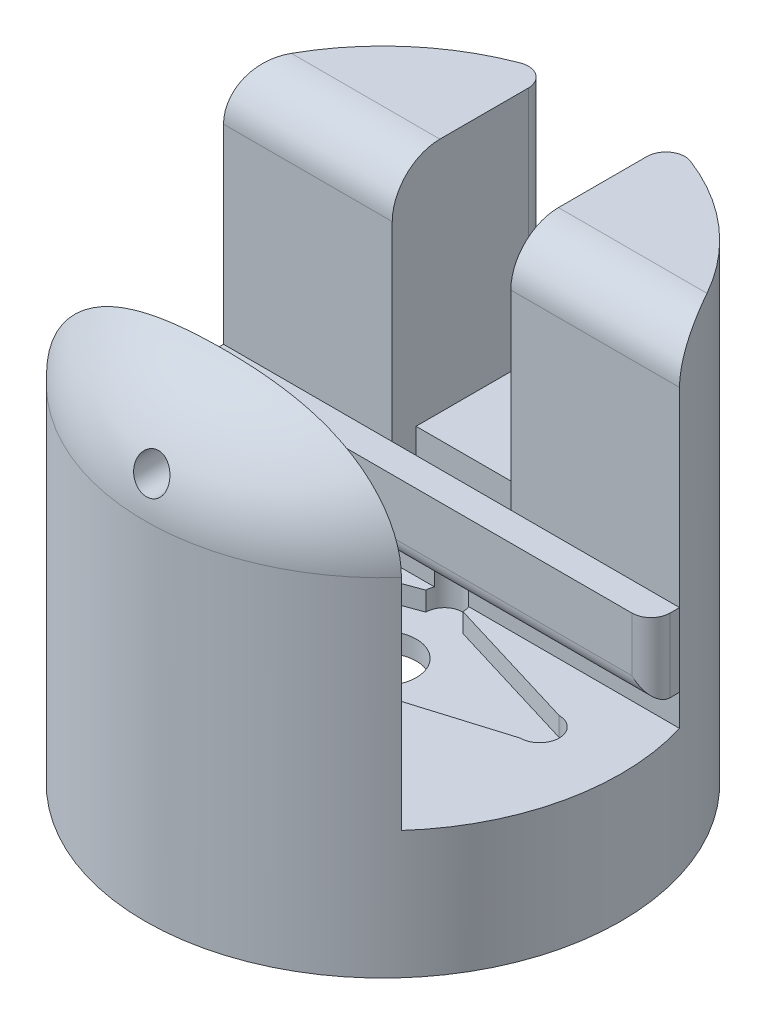
from build123d import *

# Parameters (mm, degrees)
SKETCH1_R           = 25
SKETCH1_R_2         = 22.5
BOSS_EXTRUDE1_DEPTH = 9.4
SKETCH2_R           = 25
BOSS_EXTRUDE2_DEPTH = 40
SKETCH3_W           = 55.38055132
SKETCH3_H           = 33.998264421
CUT_EXTRUDE1_DEPTH  = 36
SKETCH4_R           = 3.5
CUT_EXTRUDE2_DEPTH  = 36
CUT_EXTRUDE3_START  = -2
SKETCH5_R           = 3.5
SKETCH5_R_2         = 2.05
SKETCH5_R_3         = 1.95
CUT_EXTRUDE3_DEPTH  = 2
SKETCH5_3_R         = 1.95
CUT_EXTRUDE4_DEPTH  = 2
SKETCH6_W           = 12.45
SKETCH6_H           = 22.55
CUT_EXTRUDE5_DEPTH  = 42
SKETCH6_4_W         = 12.45
SKETCH6_4_H         = 4.85
CUT_EXTRUDE6_DEPTH  = 2.5
SKETCH6_5_W         = 12.45
SKETCH6_5_H         = 2.312362619
CUT_EXTRUDE7_DEPTH  = 28.5
SKETCH7_W           = 47.88210926
SKETCH7_H           = 3
BOSS_EXTRUDE3_DEPTH = 3
SKETCH8_W           = 47.88210926
SKETCH8_H           = 3
BOSS_EXTRUDE4_DEPTH = 4.7
FILLET1_R           = 5
FILLET2_R           = 2
FILLET3_R           = 2
BOSS_EXTRUDE5_DEPTH = 35
FILLET4_R           = 12
SKETCH10_R          = 1.8
CUT_EXTRUDE8_DEPTH  = 36


with BuildPart() as part:
    # Sketch1 → Boss-Extrude1 (new body)
    with BuildSketch(Plane(origin=(0, 0, 0), x_dir=(1, 0, 0), z_dir=(0, 1, 0))):
        with Locations(Location((0, 0, 0), (0, 0, 270))):
            Circle(SKETCH1_R)
        with Locations(Location((0, 0, 0), (0, 0, 270))):
            Circle(SKETCH1_R_2, mode=Mode.SUBTRACT)
    extrude(amount=BOSS_EXTRUDE1_DEPTH)

    # Sketch2 → Boss-Extrude2 (add)
    with BuildSketch(Plane(origin=(0, 9.4, 0), x_dir=(1, 0, 0), z_dir=(0, 1, 0))):
        with Locations(Location((0, 0, 0), (0, 0, 270))):
            Circle(SKETCH2_R)
    extrude(amount=BOSS_EXTRUDE2_DEPTH)

    # Sketch3 → Cut-Extrude1 (cut)
    with BuildSketch(Plane(origin=(0, 49.4, 0), x_dir=(1, 0, 0), z_dir=(0, 1, 0))):
        with Locations((-2.69027566, -9.800111221)):
            Rectangle(SKETCH3_W, SKETCH3_H)
    extrude(amount=-CUT_EXTRUDE1_DEPTH, mode=Mode.SUBTRACT)

    # Sketch4 → Cut-Extrude2 (cut)
    with BuildSketch(Plane.XZ.offset(-9.4)):
        with Locations(Location((0, 0, 0), (0, 0, 270))):
            Circle(SKETCH4_R)
    extrude(amount=-CUT_EXTRUDE2_DEPTH, mode=Mode.SUBTRACT)

    # Sketch5 → Cut-Extrude3 (cut)
    # profile 1 of 6: a face of its own
    with BuildSketch(Plane(origin=(0, 13.4, 0), x_dir=(1, 0, 0), z_dir=(0, 1, 0)).offset(CUT_EXTRUDE3_START)):
        with BuildLine():
            Line((-1.95, 6.45), (-14.05, 2.05))
            ThreePointArc((-14.05, 2.05), (-12.600431099, 1.449568901), (-12, 0))
            ThreePointArc((-12, 0), (-12.600431099, -1.449568901), (-14.05, -2.05))
            Line((-14.05, -2.05), (-1.95, -6.45))
            ThreePointArc((-1.95, -6.45), (0, -4.5), (1.95, -6.45))
            Line((1.95, -6.45), (16.45, -2.05))
            ThreePointArc((16.45, -2.05), (14.4, 0), (16.45, 2.05))
            Line((16.45, 2.05), (1.95, 6.45))
            ThreePointArc((1.95, 6.45), (0, 4.5), (-1.95, 6.45))
        make_face()
        with Locations(Location((0, 0, 0), (0, 0, 90))):
            Circle(SKETCH5_R, mode=Mode.SUBTRACT)
    # profile 2 of 6: a face of its own
    with BuildSketch(Plane(origin=(0, 13.4, 0), x_dir=(1, 0, 0), z_dir=(0, 1, 0)).offset(CUT_EXTRUDE3_START)):
        with BuildLine():
            ThreePointArc((-1.800407609, 7.199020989), (-1.912236235, 6.831906509), (-1.95, 6.45))
            ThreePointArc((-1.95, 6.45), (0, 4.5), (1.95, 6.45))
            ThreePointArc((1.95, 6.45), (1.912236235, 6.831906509), (1.800407609, 7.199020989))
            Line((1.800407609, 7.199020989), (-1.800407609, 7.199020989))
        make_face()
    # profile 3 of 6: a face of its own
    with BuildSketch(Plane(origin=(0, 13.4, 0), x_dir=(1, 0, 0), z_dir=(0, 1, 0)).offset(CUT_EXTRUDE3_START)):
        with BuildLine():
            ThreePointArc((1.800407609, 7.199020989), (0, 8.4), (-1.800407609, 7.199020989))
            Line((-1.800407609, 7.199020989), (1.800407609, 7.199020989))
        make_face()
    # profile 4 of 6: a face of its own
    with BuildSketch(Plane(origin=(0, 13.4, 0), x_dir=(1, 0, 0), z_dir=(0, 1, 0)).offset(CUT_EXTRUDE3_START)):
        with Locations((-14.05, 0)):
            Circle(SKETCH5_R_2)
    # profile 5 of 6: a face of its own
    with BuildSketch(Plane(origin=(0, 13.4, 0), x_dir=(1, 0, 0), z_dir=(0, 1, 0)).offset(CUT_EXTRUDE3_START)):
        with Locations((16.45, 0)):
            Circle(SKETCH5_R_2)
    # profile 6 of 6: a face of its own
    with BuildSketch(Plane(origin=(0, 13.4, 0), x_dir=(1, 0, 0), z_dir=(0, 1, 0)).offset(CUT_EXTRUDE3_START)):
        with Locations((0, -6.45)):
            Circle(SKETCH5_R_3)
    extrude(amount=CUT_EXTRUDE3_DEPTH, mode=Mode.SUBTRACT)

    # Sketch5<3> → Cut-Extrude4 (cut)
    with BuildSketch(Plane(origin=(0, 13.4, 0), x_dir=(1, 0, 0), z_dir=(0, 1, 0))):
        with Locations((0, 6.45)):
            Circle(SKETCH5_3_R)
    extrude(amount=CUT_EXTRUDE4_DEPTH, mode=Mode.SUBTRACT)

    # Sketch6 → Cut-Extrude5 (cut)
    with BuildSketch(Plane.XY.offset(-7.199020989)):
        with Locations((0, 35.812637381)):
            Rectangle(SKETCH6_W, SKETCH6_H)
    extrude(amount=-CUT_EXTRUDE5_DEPTH, mode=Mode.SUBTRACT)

    # Sketch6<4> → Cut-Extrude6 (cut)
    with BuildSketch(Plane.XY.offset(-7.199020989)):
        with Locations((0, 22.112637381)):
            Rectangle(SKETCH6_4_W, SKETCH6_4_H)
    extrude(amount=-CUT_EXTRUDE6_DEPTH, mode=Mode.SUBTRACT)

    # Sketch6<5> → Cut-Extrude7 (cut)
    with BuildSketch(Plane.XY.offset(-7.199020989)):
        with Locations((0, 48.243818691)):
            Rectangle(SKETCH6_5_W, SKETCH6_5_H)
    extrude(amount=-CUT_EXTRUDE7_DEPTH, mode=Mode.SUBTRACT)

    # Sketch7 → Boss-Extrude3 (add)
    with BuildSketch(Plane.XY.offset(-7.199020989)):
        with Locations((0, 18.187637381)):
            Rectangle(SKETCH7_W, SKETCH7_H)
    extrude(amount=BOSS_EXTRUDE3_DEPTH)

    # Sketch8 → Boss-Extrude4 (add)
    with BuildSketch(Plane(origin=(0, 19.687637381, 0), x_dir=(1, 0, 0), z_dir=(0, 1, 0))):
        with Locations((0, 5.699020989)):
            Rectangle(SKETCH8_W, SKETCH8_H)
    extrude(amount=BOSS_EXTRUDE4_DEPTH)

    # Fillet1
    fillet1_edges = [part.edges().sort_by_distance(p)[0] for p in [
        (-15.083027315, 49.4, -7.199020989),
        (15.083027315, 49.4, -7.199020989),
    ]]
    fillet(fillet1_edges, radius=FILLET1_R)

    # Fillet2
    fillet2_edges = [part.edges().sort_by_distance(p)[0] for p in [
        (6.225, 36.96881869, -24.212587119),
        (-6.225, 36.96881869, -24.212587119),
    ]]
    fillet(fillet2_edges, radius=FILLET2_R)

    # Fillet3
    fillet3_edges = [part.edges().sort_by_distance(p)[0] for p in [
        (-23.94105463, 20.537637381, -4.199020989),
        (0, 16.687637381, -4.199020989),
        (23.94105463, 20.537637381, -4.199020989),
    ]]
    fillet(fillet3_edges, radius=FILLET3_R)

    # Sketch9 → Boss-Extrude5 (add)
    with BuildSketch(Plane(origin=(0, 13.4, 0), x_dir=(1, 0, 0), z_dir=(0, 1, 0))):
        with BuildLine():
            Line((18.619699915, -16.682529037), (-18.619699915, -16.682529037))
            ThreePointArc((-18.619699915, -16.682529037), (0, -25), (18.619699915, -16.682529037))
        make_face()
    extrude(amount=BOSS_EXTRUDE5_DEPTH)

    # Fillet4
    # the kernel refuses this fillet: 12 mm, written as the material it takes off along each edge
    with BuildSketch(Plane(origin=(0, 48.4, 0), x_dir=(-0.8915807568580754, 0, -0.4528617382826481), z_dir=(0.4528617382826481, 0, -0.8915807568580754))) as fillet4_piece_1_section:
        with BuildLine():
            CenterArc((25 - FILLET4_R, -FILLET4_R), FILLET4_R, 0, 90)
            Line((25 - FILLET4_R, 0), (25, 0))
            Line((25, 0), (25, -FILLET4_R))
        make_face()
    fillet4_piece_1 = revolve(axis=Axis((0, 48.4, 0), (0, 1, 0)), revolution_arc=233.854877773, mode=Mode.PRIVATE)
    fillet4_piece_1 = split(fillet4_piece_1, bisect_by=Plane(origin=(0, 43.523140853, 16.682529037), z_dir=(0, 0, 1)), keep=Keep.TOP, mode=Mode.PRIVATE)
    add(fillet4_piece_1, mode=Mode.SUBTRACT)

    # Sketch10 → Cut-Extrude8 (cut)
    with BuildSketch(Plane(origin=(0, 0, 16.682529037), x_dir=(-1, 0, 0), z_dir=(0, 0, -1))):
        with Locations((0, 40.29)):
            Circle(SKETCH10_R)
    extrude(amount=-CUT_EXTRUDE8_DEPTH, mode=Mode.SUBTRACT)


solid = part.part
